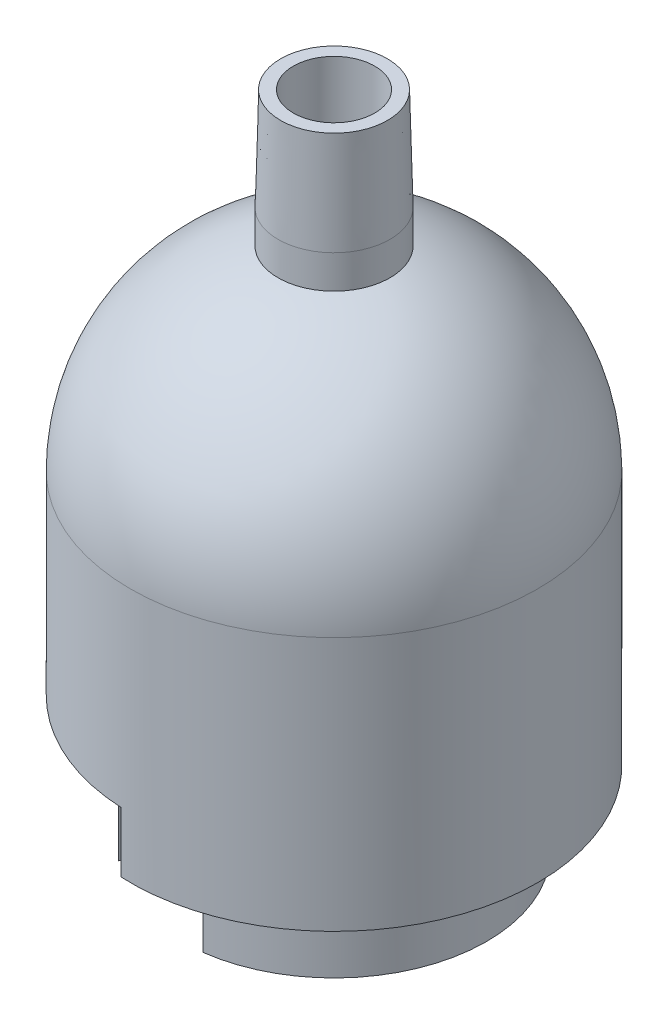
from build123d import *

# Parameters (mm, degrees)
ESBO_O1_R                     = 40
ESBO_O1_R_2                   = 30
RESSALTO_EXTRUS_O1_DEPTH      = 50
ESBO_O2_R                     = 1.5
CORTE_EXTRUS_O1_DEPTH         = 6
CORTE_EXTRUS_O2_DEPTH         = 11.84997677
RESSALTO_EXTRUS_O2_DEPTH      = 26.84997677
RESSALTO_EXTRUS_O2_DEPTH_BACK = 10
REVOLU_O1_ANGLE               = 180
RESSALTO_EXTRUS_O5_DEPTH      = 5
RESSALTO_EXTRUS_O5_DEPTH_BACK = 2
ESBO_O10_R                    = 11
ESBO_O13_R                    = 8
CORTE_EXTRUS_O4_DEPTH         = 40


# Read off the part's stored shape, not the designer's step: Limites1
with BuildPart() as part:
    # Esboço1 → Ressalto-extrusão1 (new body)
    with BuildSketch(Plane(origin=(0, 0, 0), x_dir=(1, 0, 0), z_dir=(0, 1, 0))):
        with Locations(Location((0, 0, 0), (0, 0, 270))):
            Circle(ESBO_O1_R)
        with Locations(Location((0, 0, 0), (0, 0, 270))):
            Circle(ESBO_O1_R_2, mode=Mode.SUBTRACT)
    extrude(amount=RESSALTO_EXTRUS_O1_DEPTH)

    # Esboço2 → Corte-extrusão1 (cut)
    with BuildSketch(Plane(origin=(0, 0, 0), x_dir=(-1, 0, 0), z_dir=(0, -1, 0))):
        with Locations(Location((-21.160269083, -29.124611797, 0), (0, 0, 90))):
            Circle(ESBO_O2_R)
        with Locations(Location((-34.238034587, -11.124611797, 0), (0, 0, 90))):
            Circle(ESBO_O2_R)
        with Locations(Location((-34.238034587, 11.124611797, 0), (0, 0, 90))):
            Circle(ESBO_O2_R)
        with Locations(Location((21.160269083, 29.124611797, 0), (0, 0, 90))):
            Circle(ESBO_O2_R)
        with Locations(Location((34.238034587, 11.124611797, 0), (0, 0, 90))):
            Circle(ESBO_O2_R)
        with Locations(Location((34.238034587, -11.124611797, 0), (0, 0, 90))):
            Circle(ESBO_O2_R)
    extrude(amount=-CORTE_EXTRUS_O1_DEPTH, mode=Mode.SUBTRACT)

    # Esboço3 → Corte-extrusão2 (cut)
    with BuildSketch(Plane(origin=(0, 0, 0), x_dir=(-1, 0, 0), z_dir=(0, -1, 0))):
        with BuildLine():
            ThreePointArc((30.293924668, -13.087327008), (31.253408489, 10.593604572), (16.092357529, 28.81034587))
            Line((16.092357529, 28.81034587), (19.505887914, 34.921631358))
            ThreePointArc((19.505887914, 34.921631358), (8.030354378, 39.185627576), (-4.197370073, 39.779166463))
            Line((-4.197370073, 39.779166463), (-3.148027555, 29.834374847))
            ThreePointArc((-3.148027555, 29.834374847), (29.911212101, 2.306380417), (1.462902849, -29.964310692))
            Line((1.462902849, -29.964310692), (1.950537132, -39.952414256))
            ThreePointArc((1.950537132, -39.952414256), (22.185986252, -33.283359416), (36.126859334, -17.171197823))
            Line((36.126859334, -17.171197823), (30.293924668, -13.087327008))
        make_face()
    extrude(amount=-CORTE_EXTRUS_O2_DEPTH, mode=Mode.SUBTRACT)

    # Esboço4 → Ressalto-extrusão2 (add, two sides: drawn at the far end of the back side and taken through both)
    with BuildSketch(Plane(origin=(0, 11.84997677, 0), x_dir=(-1, 0, 0), z_dir=(0, -1, 0)).offset(-RESSALTO_EXTRUS_O2_DEPTH_BACK)):
        with BuildLine():
            Line((-4.008838629, -29.730947056), (-4.700362463, -27.602655537))
            ThreePointArc((-4.700362463, -27.602655537), (-8.119302432, 26.79695744), (19.230258499, -20.351834268))
            Line((19.230258499, -20.351834268), (19.909240802, -22.441526924))
            ThreePointArc((19.909240802, -22.441526924), (-8.745833796, 28.696870757), (-4.008838629, -29.730947056))
        make_face()
    extrude(amount=RESSALTO_EXTRUS_O2_DEPTH + RESSALTO_EXTRUS_O2_DEPTH_BACK)

    # Esboço9 → Revolução1 (revolve)
    with BuildSketch(Plane(origin=(0, 50, 0), x_dir=(1, 0, 0), z_dir=(0, 1, 0))):
        with BuildLine():
            Line((-40, 0), (-30, 0))
            ThreePointArc((-30, 0), (0, 30), (30, 0))
            Line((30, 0), (40, 0))
            ThreePointArc((40, 0), (0, 40), (-40, 0))
        make_face()
    revolve(axis=Axis((-40, 50, 0), (1, 0, 0)), revolution_arc=REVOLU_O1_ANGLE)

    # Esboço10 → Ressalto-extrusão5 (add, two sides: drawn at the far end of the back side and taken through both)
    with BuildSketch(Plane(origin=(0, 90, 0), x_dir=(1, 0, 0), z_dir=(0, 1, 0)).offset(-RESSALTO_EXTRUS_O5_DEPTH_BACK)):
        with Locations(Location((0, 0, 0), (0, 0, 270))):
            Circle(ESBO_O10_R)
    extrude(amount=RESSALTO_EXTRUS_O5_DEPTH + RESSALTO_EXTRUS_O5_DEPTH_BACK)

    # Limites1 outline → Limites1 (revolve)
    with BuildSketch(Plane.XY):
        Polygon((11, 95), (10.5, 115), (0, 115), (0, 95), align=None)
    revolve(axis=Axis((0, 0, 0), (0, 1, 0)))

    # Esboço13 → Corte-extrusão4 (cut)
    with BuildSketch(Plane(origin=(0, 115, 0), x_dir=(1, 0, 0), z_dir=(0, 1, 0))):
        with Locations(Location((0, 0, 0), (0, 0, 270))):
            Circle(ESBO_O13_R)
    extrude(amount=-CORTE_EXTRUS_O4_DEPTH, mode=Mode.SUBTRACT)


solid = part.part
